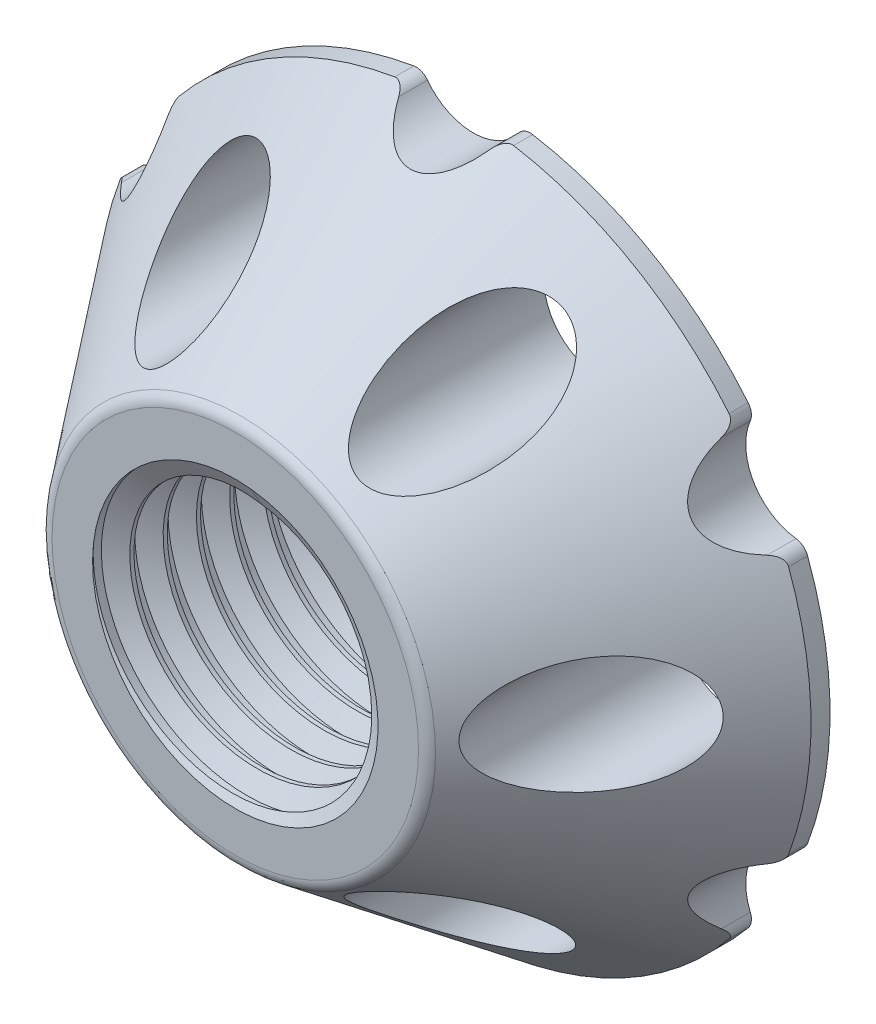
from build123d import *

# Parameters (mm, degrees)
SKETCH4_R               = 15
CUT_EXTRUDE1_DEPTH      = 59.630196998
SWEEP1_PITCH            = 3.5
CUT_EXTRUDE2_DEPTH      = 63.363243782
CUT_EXTRUDE2_DEPTH_BACK = 63.363243782
SKETCH7_W               = 40
SKETCH7_H               = 10
SKETCH9_R               = 6
CUT_EXTRUDE3_DEPTH      = 59.63019704
SKETCH10_R              = 6
CUT_EXTRUDE4_DEPTH      = 59.393044842
FILLET1_R               = 1.5


with BuildPart() as part:
    # Sketch2 → Revolve1 (revolve)
    with BuildSketch(Plane(origin=(0, 0, 0), x_dir=(0, 0, -1), z_dir=(1, 0, 0)), mode=Mode.PRIVATE) as revolve1_sk:
        Polygon((-25, 0), (0, 0), (0, 37.5), (-2, 37.5), (-25, 20), align=None)
    revolve(revolve1_sk.sketch.rotate(Axis((0, 0, 25), (0, 0, -1)), 90), axis=Axis((0, 0, 25), (0, 0, -1)))

    # Sketch4 → Cut-Extrude1 (cut, through all)
    with BuildSketch(Plane.XY.offset(25)):
        Circle(SKETCH4_R)
    extrude(amount=-CUT_EXTRUDE1_DEPTH, mode=Mode.SUBTRACT)

    # Sweep1: the profile of Sketch5 profile screwed along a left-hand helix of 11 turns, 12 arcs to a turn; built about Z, then put on its axis
    sweep1_z = Axis((0, 0, 0), (0, 0, 1))
    sweep1_corners = [(13.1055, 0, -0.21875), (15.0003, 0, -1.31271329), (15.0003, 0, 1.31271329), (13.1055, 0, 0.21875)]
    with BuildLine(mode=Mode.PRIVATE) as sweep1_profile:
        Line(sweep1_corners[0], sweep1_corners[1])
        Line(sweep1_corners[1], sweep1_corners[2])
        Line(sweep1_corners[2], sweep1_corners[3])
        Line(sweep1_corners[3], sweep1_corners[0])
    sweep1_cap = Face(sweep1_profile.wire())
    sweep1_turn_angles = [0, -15, -30, -45, -60, -75, -90, -105, -120, -135, -150, -165, -180, -195, -210, -225, -240, -255, -270, -285, -300, -315, -330, -345, -360]
    sweep1_turn_weights = [1, 0.9659258262890683, 1, 0.9659258262890683, 1, 0.9659258262890683, 1, 0.9659258262890683, 1, 0.9659258262890683, 1, 0.9659258262890683, 1, 0.9659258262890683, 1, 0.9659258262890683, 1, 0.9659258262890683, 1, 0.9659258262890683, 1, 0.9659258262890683, 1, 0.9659258262890683, 1]
    sweep1_turn_rails = [Edge.make_bspline([Vector(p[0], p[1], 0).rotate(sweep1_z, sweep1_turn_angles[k]) / sweep1_turn_weights[k] + Vector(0, 0, p[2] + -SWEEP1_PITCH * sweep1_turn_angles[k] / 360) for k in range(25)], [0, 0, 0, 1, 1, 2, 2, 3, 3, 4, 4, 5, 5, 6, 6, 7, 7, 8, 8, 9, 9, 10, 10, 11, 11, 12, 12, 12], 2, sweep1_turn_weights) for p in sweep1_corners]
    sweep1_turn_sides = [Face.make_surface_from_curves(sweep1_turn_rails[p[0]], sweep1_turn_rails[p[1]]) for p in [(0, 1), (1, 2), (2, 3), (3, 0)]]
    sweep1 = Plane(origin=(0, 0, -7), x_dir=(1, 0, 0), z_dir=(0, 0, 1)) * Solid(Shell([*[p.moved(Location((0, 0, SWEEP1_PITCH * i))) for i in range(11) for p in sweep1_turn_sides], sweep1_cap, sweep1_cap.rotate(sweep1_z, -3960).moved(Location((0, 0, -SWEEP1_PITCH * -3960 / 360)))]))
    add(sweep1)

    # Sketch7 → Cut-Extrude2 (cut, two sides: drawn at the far end of the back side and taken through both)
    with BuildSketch(Plane(origin=(0, 0, 0), x_dir=(1, 0, 0), z_dir=(0, 1, 0)).offset(-CUT_EXTRUDE2_DEPTH_BACK)):
        with Locations((0, 5)):
            Rectangle(SKETCH7_W, SKETCH7_H)
        with Locations((0, -30)):
            Rectangle(SKETCH7_W, SKETCH7_H)
    extrude(amount=CUT_EXTRUDE2_DEPTH + CUT_EXTRUDE2_DEPTH_BACK, mode=Mode.SUBTRACT)

    # Sketch8 → Cut-Revolve2 (revolve, cut)
    with BuildSketch(Plane(origin=(0, 0, 0), x_dir=(1, 0, 0), z_dir=(0, 1, 0))):
        Polygon((15, 0), (11.5, 0), (11.5, -2.020725942), align=None)
        Polygon((15, -25), (11.5, -25), (11.5, -22.979274058), align=None)
    revolve(axis=Axis((0, 0, 0), (0, 0, 1)), mode=Mode.SUBTRACT)

    # Sketch9 → Cut-Extrude3 (cut, through all)
    with BuildSketch(Plane(origin=(0, 0, 0), x_dir=(-1, 0, 0), z_dir=(0, 0, -1))):
        with Locations((0, 40)):
            Circle(SKETCH9_R)
        with Locations((34.641016151, 20)):
            Circle(SKETCH9_R)
        with Locations((34.641016151, -20)):
            Circle(SKETCH9_R)
        with Locations((0, -40)):
            Circle(SKETCH9_R)
        with Locations((-34.641016151, -20)):
            Circle(SKETCH9_R)
        with Locations((-34.641016151, 20)):
            Circle(SKETCH9_R)
    extrude(amount=-CUT_EXTRUDE3_DEPTH, mode=Mode.SUBTRACT)

    # Sketch10 → Cut-Extrude4 (cut, through all)
    with BuildSketch(Plane(origin=(0, 0, 0), x_dir=(-1, 0, 0), z_dir=(0, 0, -1))):
        with Locations((13.75, 23.815698604)):
            Circle(SKETCH10_R)
        with Locations((26.875, 0)):
            Circle(SKETCH10_R)
        with Locations((12.8125, -23.274432727)):
            Circle(SKETCH10_R)
        with Locations((-14.375, -22.733166849)):
            Circle(SKETCH10_R)
        with Locations((-27.5, 1.082531755)):
            Circle(SKETCH10_R)
        with Locations((-13.4375, 24.356964481)):
            Circle(SKETCH10_R)
    extrude(amount=-CUT_EXTRUDE4_DEPTH, mode=Mode.SUBTRACT)

    # Fillet1
    # the kernel refuses this fillet: 1.5 mm, written as the material it takes off along each edge
    with BuildSketch(Plane(origin=(-34.787923647, -14.001798754, -2.478162851), x_dir=(0.9988497503431563, -0.04794972616620835, 0), z_dir=(0, 0, 1)), Plane(origin=(-5.268048404, -37.128125, -2.478162851), x_dir=(0.5409505561358486, 0.8410543952779249, 0), z_dir=(0, 0, 1)), Plane(origin=(29.519875243, -23.126326246, -2.478162851), x_dir=(-0.4578991942074583, 0.889004121443855, 0), z_dir=(0, 0, 1))) as fillet1_piece_1:
        with BuildLine():
            CenterArc((0.9772889, 1.496064411), FILLET1_R, 203.158087702, 62.690538058)
            ThreePointArc((-0.401845997, 0.906160236), (-0.203917279, 0.451752274), (0, 0))
            ThreePointArc((0, 0), (0.434350622, 0.015742357), (0.868701245, 0))
        make_face()
    extrude(amount=6.956325702, mode=Mode.SUBTRACT)
    with BuildSketch(Plane(origin=(-29.519875243, -23.126326246, -2.478162851), x_dir=(0.6270524413319682, -0.7789770444753931, 0), z_dir=(0, 0, 1)), Plane(origin=(5.268048404, -37.128125, -2.478162851), x_dir=(0.9881401301465912, 0.15355482146086397, 0), z_dir=(0, 0, 1)), Plane(origin=(-34.787923647, 14.001798754, -2.478162851), x_dir=(-0.3610876888146363, -0.9325318659362287, 0), z_dir=(0, 0, 1))) as fillet1_piece_2:
        with BuildLine():
            CenterArc((0.971439838, 1.49986898), FILLET1_R, 208.066754777, 62.690538058)
            ThreePointArc((-0.352160188, 0.794119043), (-0.161689294, 0.403441268), (0, 0))
            ThreePointArc((0, 0), (0.49563257, -0.003275498), (0.99126514, 0))
        make_face()
    extrude(amount=6.956325702, mode=Mode.SUBTRACT)
    with BuildSketch(Plane(origin=(34.787923647, -14.001798754, -2.478162851), x_dir=(-0.9988497503431778, -0.04794972616575923, 0), z_dir=(0, 0, 1)), Plane(origin=(29.519875243, 23.126326246, -2.478162851), x_dir=(-0.4578991942074546, -0.8890041214438569, 0), z_dir=(0, 0, 1)), Plane(origin=(-5.268048404, 37.128125, -2.478162851), x_dir=(0.5409505561359349, -0.8410543952778695, 0), z_dir=(0, 0, 1))) as fillet1_piece_3:
        with BuildLine():
            CenterArc((0.9772889, -1.496064411), FILLET1_R, 94.15137424, 62.690538058)
            ThreePointArc((-0.401845997, -0.906160236), (-0.203917279, -0.451752274), (0, 0))
            ThreePointArc((0, 0), (0.434350622, -0.015742357), (0.868701245, 0))
        make_face()
    extrude(amount=6.956325702, mode=Mode.SUBTRACT)
    with BuildSketch(Plane(origin=(34.787923647, 14.001798754, -2.478162851), x_dir=(0.361087688814547, -0.9325318659362632, 0), z_dir=(0, 0, 1)), Plane(origin=(5.268048404, 37.128125, -2.478162851), x_dir=(0.9881401301465941, -0.15355482146084537, 0), z_dir=(0, 0, 1)), Plane(origin=(-29.519875243, 23.126326246, -2.478162851), x_dir=(0.627052441331982, 0.778977044475382, 0), z_dir=(0, 0, 1))) as fillet1_piece_4:
        with BuildLine():
            CenterArc((0.971439838, -1.49986898), FILLET1_R, 89.242707165, 62.690538058)
            ThreePointArc((-0.352160188, -0.794119043), (-0.161689294, -0.403441268), (0, 0))
            ThreePointArc((0, 0), (0.49563257, 0.003275498), (0.99126514, 0))
        make_face()
    extrude(amount=6.956325702, mode=Mode.SUBTRACT)
    with BuildSketch(Plane(origin=(0, 0, 25), x_dir=(1, 0, 0), z_dir=(0, 1, 0))) as fillet1_piece_5:
        with BuildLine():
            CenterArc((20 - FILLET1_R * 0.495682262315, FILLET1_R), FILLET1_R, 270, 52.733598099)
            Line((20 - FILLET1_R * 0.495682262315, 0), (20, 0))
            Line((20, 0), (20 + FILLET1_R * 0.300146431806, FILLET1_R * 0.394478167517))
        make_face()
    revolve(axis=Axis((0, 0, 25), (0, 0, -1)), mode=Mode.SUBTRACT)


solid = part.part
